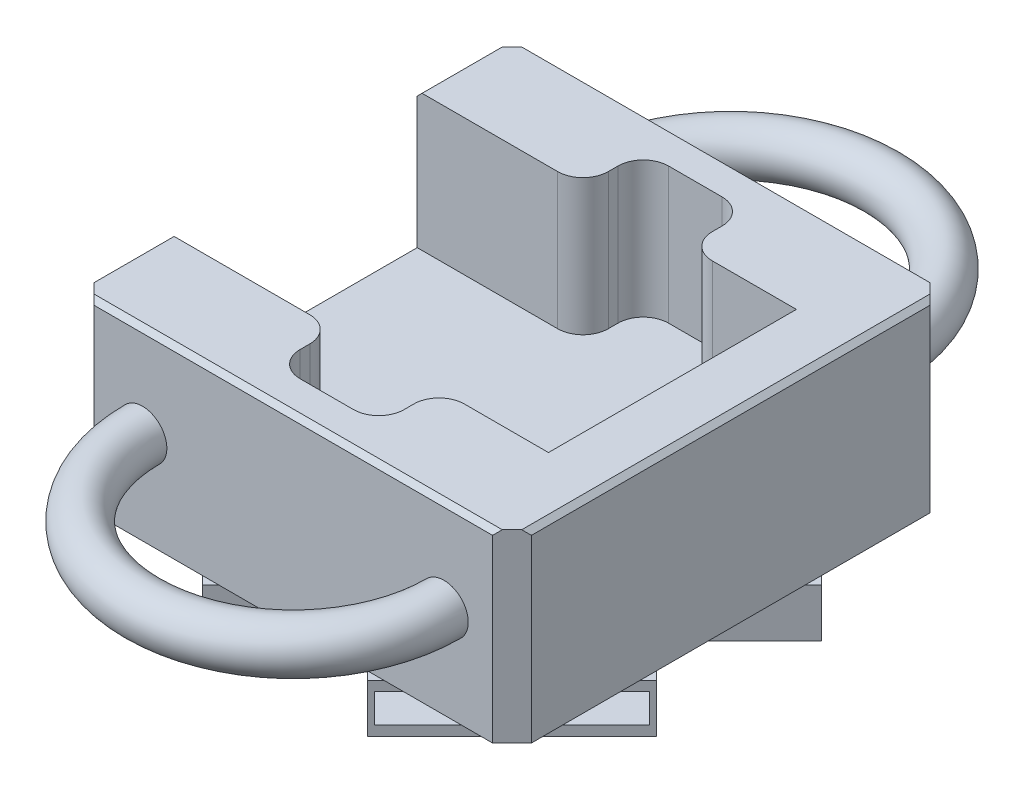
from build123d import *

# Parameters (mm, degrees)
SKETCH1_W             = 45
SKETCH1_H             = 45
BOSS_EXTRUDE1_DEPTH   = 14
CUT_EXTRUDE1_DEPTH    = 35.763486592
CHAMFER1_SIZE         = 0.5
CHAMFER2_SIZE         = 2
SKETCH4_R             = 1.75
CUT_EXTRUDE2_DEPTH    = 35.763486592
SKETCH5_R             = 1.75
SKETCH5_W             = 41
SKETCH5_H             = 2
SKETCH5_W_2           = 2
SKETCH5_H_2           = 41
BOSS_EXTRUDE3_DEPTH   = 5
SKETCH6_R             = 1.75
BOSS_EXTRUDE4_DEPTH   = 19
REVOLVE4_OUTLINE_R    = 2.5
REVOLVE4_ANGLE        = 180
SKETCH27_W            = 21
SKETCH27_H            = 12
SKETCH27_W_2          = 12
SKETCH27_H_2          = 21
BOSS_EXTRUDE6_DEPTH   = 5
BODY_MOVE_COPY1_ANGLE = 45
SKETCH31_W            = 20
SKETCH31_H            = 3
CUT_EXTRUDE5_DEPTH    = 71.129894544
SKETCH33_W            = 20
SKETCH33_H            = 3
CUT_EXTRUDE6_DEPTH    = 71.129894544


# Read off the part's stored shape, not the designer's step: Revolve4, Split1
with BuildPart() as part:
    # Sketch1 → Boss-Extrude1 (new body)
    with BuildSketch(Plane(origin=(0, 0, 0), x_dir=(1, 0, 0), z_dir=(0, 1, 0))):
        Rectangle(SKETCH1_W, SKETCH1_H)
    extrude(amount=BOSS_EXTRUDE1_DEPTH)

    # Sketch3 → Cut-Extrude1 (cut, through all)
    with BuildSketch(Plane(origin=(0, 14, 0), x_dir=(1, 0, 0), z_dir=(0, 1, 0))):
        with BuildLine():
            Line((-22.5, 12.75), (-8.05, 12.75))
            ThreePointArc((-8.05, 12.75), (-6.211522369, 13.511522369), (-5.45, 15.35))
            Line((-5.45, 15.35), (-5.45, 16.35))
            ThreePointArc((-5.45, 16.35), (-4.688477631, 18.188477631), (-2.85, 18.95))
            Line((-2.85, 18.95), (2.65, 18.95))
            ThreePointArc((2.65, 18.95), (4.488477631, 18.188477631), (5.25, 16.35))
            Line((5.25, 16.35), (5.25, 15.35))
            ThreePointArc((5.25, 15.35), (6.011522369, 13.511522369), (7.85, 12.75))
            Line((7.85, 12.75), (16.5, 12.75))
            Line((16.5, 12.75), (16.5, -12.75))
            Line((16.5, -12.75), (7.85, -12.75))
            ThreePointArc((7.85, -12.75), (6.011522369, -13.511522369), (5.25, -15.35))
            Line((5.25, -15.35), (5.25, -16.35))
            ThreePointArc((5.25, -16.35), (4.488477631, -18.188477631), (2.65, -18.95))
            Line((2.65, -18.95), (-2.85, -18.95))
            ThreePointArc((-2.85, -18.95), (-4.688477631, -18.188477631), (-5.45, -16.35))
            Line((-5.45, -16.35), (-5.45, -15.35))
            ThreePointArc((-5.45, -15.35), (-6.211522369, -13.511522369), (-8.05, -12.75))
            Line((-8.05, -12.75), (-22.5, -12.75))
            Line((-22.5, -12.75), (-22.5, 12.75))
        make_face()
    extrude(amount=-CUT_EXTRUDE1_DEPTH, mode=Mode.SUBTRACT)

    # Chamfer1
    chamfer1_edges = [part.edges().sort_by_distance(p)[0] for p in [
        (-22.5, 14, -17.625),
        (0, 14, 22.5),
        (-22.5, 14, 17.625),
        (22.5, 14, 0),
        (0, 14, -22.5),
    ]]
    chamfer(chamfer1_edges, length=CHAMFER1_SIZE)

    # Chamfer2
    # the kernel refuses this chamfer: 5.464101615, 2 mm, written as the material it takes off along each edge
    # the kernel refuses this chamfer: 5.464101615, 2 mm, written as the material it takes off along each edge
    with BuildSketch(Plane(origin=(-22.5, -5.143365976, -22.5), x_dir=(-0.027495876610585647, 0, 0.9996219169112968), z_dir=(0, 1, 0)), Plane(origin=(-22.5, -5.143365976, 22.5), x_dir=(0.9996219169112968, 0, 0.027495876610585647), z_dir=(0, 1, 0))) as chamfer2_2_piece_1:
        Polygon((CHAMFER2_SIZE * 0.999621916911, CHAMFER2_SIZE * 0.0274958766106), (-CHAMFER2_SIZE * 0.0274958766106, CHAMFER2_SIZE * 0.999621916911), (0, 0), align=None)
    extrude(amount=23.786731952, mode=Mode.SUBTRACT)
    with BuildSketch(Plane(origin=(22.5, -5.143365976, 22.5), x_dir=(-0.9996219169112968, 0, 0.027495876610585647), z_dir=(0, 1, 0)), Plane(origin=(22.5, -5.143365976, -22.5), x_dir=(0.027495876610585647, 0, 0.9996219169112968), z_dir=(0, 1, 0))) as chamfer2_2_piece_2:
        Polygon((CHAMFER2_SIZE * 0.999621916911, -CHAMFER2_SIZE * 0.0274958766106), (-CHAMFER2_SIZE * 0.0274958766106, -CHAMFER2_SIZE * 0.999621916911), (0, 0), align=None)
    extrude(amount=23.786731952, mode=Mode.SUBTRACT)

    # Sketch4 → Cut-Extrude2 (cut, through all)
    with BuildSketch(Plane(origin=(0, 14, 0), x_dir=(1, 0, 0), z_dir=(0, 1, 0))):
        with Locations(Location((-18, 17.25, 0), (0, 0, 270))):
            Circle(SKETCH4_R)
        with Locations(Location((18, 17.25, 0), (0, 0, 270))):
            Circle(SKETCH4_R)
        with Locations(Location((18, -17.25, 0), (0, 0, 270))):
            Circle(SKETCH4_R)
        with Locations(Location((-18, -17.25, 0), (0, 0, 270))):
            Circle(SKETCH4_R)
    extrude(amount=-CUT_EXTRUDE2_DEPTH, mode=Mode.SUBTRACT)

    # Sketch5 → Boss-Extrude3 (add)
    # profile 1 of 7: a face of its own
    with BuildSketch(Plane.XZ):
        with BuildLine():
            Line((20.5, 20.5), (20.5, -22.5))
            Line((20.5, -22.5), (-20.5, -22.5))
            Line((-20.5, -22.5), (-22.5, -20.5))
            Line((-22.5, -20.5), (-22.5, -12.75))
            Line((-22.5, -12.75), (-8.05, -12.75))
            ThreePointArc((-8.05, -12.75), (-6.211522369, -13.511522369), (-5.45, -15.35))
            Line((-5.45, -15.35), (-5.45, -16.35))
            ThreePointArc((-5.45, -16.35), (-4.688477631, -18.188477631), (-2.85, -18.95))
            Line((-2.85, -18.95), (2.65, -18.95))
            ThreePointArc((2.65, -18.95), (4.488477631, -18.188477631), (5.25, -16.35))
            Line((5.25, -16.35), (5.25, -15.35))
            ThreePointArc((5.25, -15.35), (6.011522369, -13.511522369), (7.85, -12.75))
            Line((7.85, -12.75), (16.5, -12.75))
            Line((16.5, -12.75), (16.5, 12.75))
            Line((16.5, 12.75), (7.85, 12.75))
            ThreePointArc((7.85, 12.75), (6.011522369, 13.511522369), (5.25, 15.35))
            Line((5.25, 15.35), (5.25, 16.35))
            ThreePointArc((5.25, 16.35), (4.488477631, 18.188477631), (2.65, 18.95))
            Line((2.65, 18.95), (-2.85, 18.95))
            ThreePointArc((-2.85, 18.95), (-4.688477631, 18.188477631), (-5.45, 16.35))
            Line((-5.45, 16.35), (-5.45, 15.35))
            ThreePointArc((-5.45, 15.35), (-6.211522369, 13.511522369), (-8.05, 12.75))
            Line((-8.05, 12.75), (-22.5, 12.75))
            Line((-22.5, 12.75), (-22.5, 20.5))
            Line((-22.5, 20.5), (20.5, 20.5))
        make_face()
        with Locations(Location((18, 17.25, 0), (0, 0, 90))):
            Circle(SKETCH5_R, mode=Mode.SUBTRACT)
        with Locations(Location((-18, -17.25, 0), (0, 0, 90))):
            Circle(SKETCH5_R, mode=Mode.SUBTRACT)
        with Locations(Location((18, -17.25, 0), (0, 0, 90))):
            Circle(SKETCH5_R, mode=Mode.SUBTRACT)
        with Locations(Location((-18, 17.25, 0), (0, 0, 90))):
            Circle(SKETCH5_R, mode=Mode.SUBTRACT)
    # profile 2 of 7: a face of its own
    with BuildSketch(Plane.XZ):
        with Locations((0, 21.5)):
            Rectangle(SKETCH5_W, SKETCH5_H)
    # profile 3 of 7: a face of its own
    with BuildSketch(Plane.XZ):
        Polygon((-22.5, 20.5), (-20.5, 20.5), (-20.5, 22.5), align=None)
    # profile 4 of 7: a face of its own
    with BuildSketch(Plane.XZ):
        Polygon((22.5, 20.5), (20.5, 20.5), (20.5, 22.5), align=None)
    # profile 5 of 7: a face of its own
    with BuildSketch(Plane.XZ):
        with Locations((21.5, 0)):
            Rectangle(SKETCH5_W_2, SKETCH5_H_2)
    # profile 6 of 7: a face of its own
    with BuildSketch(Plane.XZ):
        Polygon((20.5, -20.5), (20.5, -22.5), (22.5, -20.5), align=None)
    # profile 7 of 7: a face of its own
    with BuildSketch(Plane.XZ):
        with BuildLine():
            Line((-22.5, 12.75), (-22.5, -12.75))
            Line((-22.5, -12.75), (-8.05, -12.75))
            ThreePointArc((-8.05, -12.75), (-6.211522369, -13.511522369), (-5.45, -15.35))
            Line((-5.45, -15.35), (-5.45, -16.35))
            ThreePointArc((-5.45, -16.35), (-4.688477631, -18.188477631), (-2.85, -18.95))
            Line((-2.85, -18.95), (2.65, -18.95))
            ThreePointArc((2.65, -18.95), (4.488477631, -18.188477631), (5.25, -16.35))
            Line((5.25, -16.35), (5.25, -15.35))
            ThreePointArc((5.25, -15.35), (6.011522369, -13.511522369), (7.85, -12.75))
            Line((7.85, -12.75), (16.5, -12.75))
            Line((16.5, -12.75), (16.5, 12.75))
            Line((16.5, 12.75), (7.85, 12.75))
            ThreePointArc((7.85, 12.75), (6.011522369, 13.511522369), (5.25, 15.35))
            Line((5.25, 15.35), (5.25, 16.35))
            ThreePointArc((5.25, 16.35), (4.488477631, 18.188477631), (2.65, 18.95))
            Line((2.65, 18.95), (-2.85, 18.95))
            ThreePointArc((-2.85, 18.95), (-4.688477631, 18.188477631), (-5.45, 16.35))
            Line((-5.45, 16.35), (-5.45, 15.35))
            ThreePointArc((-5.45, 15.35), (-6.211522369, 13.511522369), (-8.05, 12.75))
            Line((-8.05, 12.75), (-22.5, 12.75))
        make_face()
    extrude(amount=BOSS_EXTRUDE3_DEPTH)

    # Sketch6 → Boss-Extrude4 (add)
    with BuildSketch(Plane(origin=(0, 14, 0), x_dir=(1, 0, 0), z_dir=(0, 1, 0))):
        with Locations((-18, 17.25)):
            Circle(SKETCH6_R)
        with Locations((18, 17.25)):
            Circle(SKETCH6_R)
        with Locations((-18, -17.25)):
            Circle(SKETCH6_R)
        with Locations((18, -17.25)):
            Circle(SKETCH6_R)
    extrude(amount=-BOSS_EXTRUDE4_DEPTH)

    # Revolve4 outline → Revolve4 (revolve)
    with BuildSketch(Plane(origin=(0, 0, 22.5), x_dir=(-1, 0, 0), z_dir=(0, 0, -1))):
        with Locations((15.5, 4.5)):
            Circle(REVOLVE4_OUTLINE_R)
    revolve4 = revolve(axis=Axis((0, 0, 22.5), (0, 1, 0)), revolution_arc=REVOLVE4_ANGLE)

    # Mirror1: Revolve4 across plane
    add(revolve4.mirror(Plane.XY))

    # Sketch27 → Boss-Extrude6 (add)
    with BuildSketch(Plane.XZ.offset(5)):
        with Locations((0, 16.5)):
            Rectangle(SKETCH27_W, SKETCH27_H)
        with Locations((-16.5, 0)):
            Rectangle(SKETCH27_W_2, SKETCH27_H_2)
        Rectangle(SKETCH27_W, SKETCH27_H_2)
        with Locations((16.5, 0)):
            Rectangle(SKETCH27_W_2, SKETCH27_H_2)
        with Locations((0, -16.5)):
            Rectangle(SKETCH27_W, SKETCH27_H)
    extrude(amount=BOSS_EXTRUDE6_DEPTH)


with BuildPart() as body_2:
    # Split1: the piece on the far side of the plane
    add(part.part)
    split(bisect_by=Plane(origin=(0, -5, 0), x_dir=(1, 0, 0), z_dir=(0, 1, 0)), keep=Keep.BOTTOM)


with BuildPart() as part_1:
    add(part.part)

    # Split1
    split(bisect_by=Plane(origin=(0, -5, 0), x_dir=(1, 0, 0), z_dir=(0, 1, 0)), keep=Keep.TOP)


with BuildPart() as body_2_1:
    # Body-Move/Copy1: moved
    add(body_2.part.rotate(Axis((0, 0, 0), (0, 1, 0)), BODY_MOVE_COPY1_ANGLE))

    # Sketch31 → Cut-Extrude5 (cut, through all)
    with BuildSketch(Plane(origin=(15.909902577, 0, 15.909902577), x_dir=(0.7071067811864872, 0, -0.707106781186608), z_dir=(0.707106781186608, 0, 0.7071067811864872))):
        with Locations((0, -7.5)):
            Rectangle(SKETCH31_W, SKETCH31_H)
    extrude(amount=-CUT_EXTRUDE5_DEPTH, mode=Mode.SUBTRACT)

    # Sketch33 → Cut-Extrude6 (cut, through all)
    with BuildSketch(Plane(origin=(-15.909902577, 0, 15.909902577), x_dir=(0.707106781186608, 0, 0.7071067811864872), z_dir=(-0.7071067811864872, 0, 0.707106781186608))):
        with Locations((0, -7.5)):
            Rectangle(SKETCH33_W, SKETCH33_H)
    extrude(amount=-CUT_EXTRUDE6_DEPTH, mode=Mode.SUBTRACT)


solid = Compound([part_1.part, body_2_1.part])
